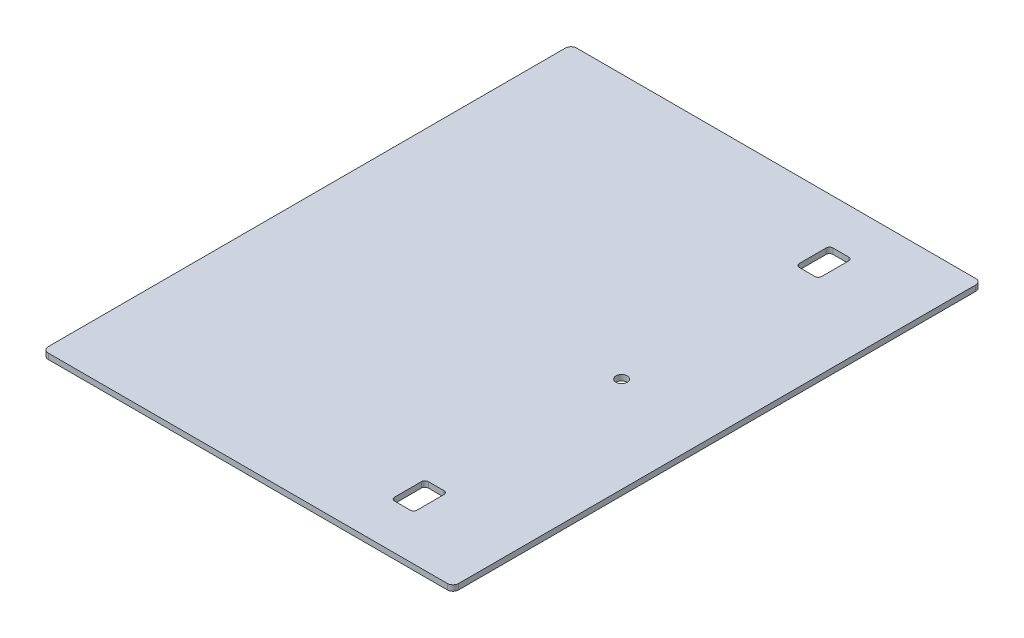
from build123d import *

# Parameters (mm, degrees)
SKETCH1_W                   = 231.775
SKETCH1_H                   = 298.45
BOSS_EXTRUDE1_DEPTH         = 3.175
F_1_4_0_25_DIAMETER_HOLE1_D = 6.35
FILLET1_R                   = 3.175
SKETCH4_W                   = 12.7
SKETCH4_H                   = 19.05
CUT_EXTRUDE1_DEPTH          = 189.96585381
FILLET2_R                   = 1.905


with BuildPart() as part:
    # Sketch1 → Boss-Extrude1 (new body)
    with BuildSketch(Plane(origin=(0, 0, 0), x_dir=(1, 0, 0), z_dir=(0, 1, 0))):
        Rectangle(SKETCH1_W, SKETCH1_H)
    extrude(amount=BOSS_EXTRUDE1_DEPTH)

    # 1/4 (0.25) Diameter Hole1 (through all)
    with Locations(Plane(origin=(0, 3.175, 0), x_dir=(1, 0, 0), z_dir=(0, 1, 0))):
        with Locations((61.9125, 0)):
            Hole(F_1_4_0_25_DIAMETER_HOLE1_D / 2)

    # Fillet1
    fillet1_edges = [part.edges().sort_by_distance(p)[0] for p in [
        (-115.8875, 1.5875, 149.225),
        (115.8875, 1.5875, 149.225),
        (-115.8875, 1.5875, -149.225),
        (115.8875, 1.5875, -149.225),
    ]]
    fillet(fillet1_edges, radius=FILLET1_R)

    # Sketch4 → Cut-Extrude1 (cut, through all)
    with BuildSketch(Plane(origin=(0, 3.175, 0), x_dir=(1, 0, 0), z_dir=(0, 1, 0))):
        with Locations((61.9125, -114.3)):
            Rectangle(SKETCH4_W, SKETCH4_H)
        with Locations((61.9125, 114.3)):
            Rectangle(SKETCH4_W, SKETCH4_H)
    extrude(amount=-CUT_EXTRUDE1_DEPTH, mode=Mode.SUBTRACT)

    # Fillet2
    fillet2_edges = [part.edges().sort_by_distance(p)[0] for p in [
        (68.2625, 1.5875, 123.825),
        (68.2625, 1.5875, 104.775),
        (55.5625, 1.5875, 104.775),
        (55.5625, 1.5875, 123.825),
        (55.5625, 1.5875, -104.775),
        (68.2625, 1.5875, -104.775),
        (68.2625, 1.5875, -123.825),
        (55.5625, 1.5875, -123.825),
    ]]
    fillet(fillet2_edges, radius=FILLET2_R)


solid = part.part
